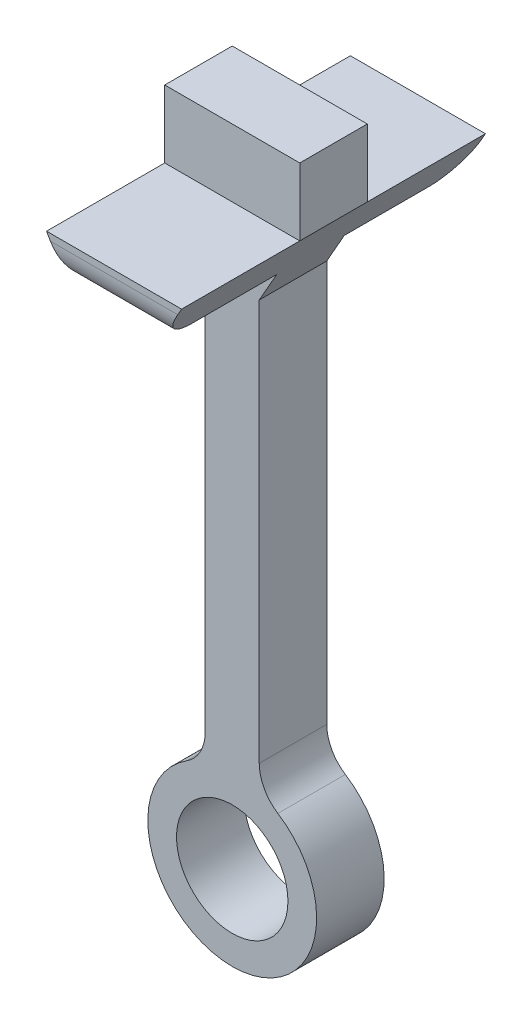
from build123d import *

# Parameters (mm, degrees)
ESQUISSE1_R             = 1.65
BOSS_EXTRU_1_DEPTH      = 2
CONG_1_R                = 1.2
BOSS_EXTRU_3_DEPTH      = 3.5
BOSS_EXTRU_3_DEPTH_BACK = 5.5
CONG_2_R                = 1


with BuildPart() as part:
    # Esquisse1 → Boss.-Extru.1 (new body)
    with BuildSketch(Plane.XY):
        with BuildLine():
            Line((1.198395722, -3.48698903), (2.398395722, -1.372264328))
            Line((2.398395722, -1.372264328), (2.398395722, 0.627735672))
            Line((2.398395722, 0.627735672), (-1.601604278, 0.627735672))
            Line((-1.601604278, 0.627735672), (-1.601604278, -1.372264328))
            Line((-1.601604278, -1.372264328), (-0.401604278, -3.48698903))
            Line((-0.401604278, -3.48698903), (-0.401604278, -16.118445174))
            ThreePointArc((-0.401604278, -16.118445174), (0.398395722, -20.98698903), (1.198395722, -16.118445174))
            Line((1.198395722, -16.118445174), (1.198395722, -3.48698903))
        make_face()
        with Locations((0.398395722, -18.48698903)):
            Circle(ESQUISSE1_R, mode=Mode.SUBTRACT)
    extrude(amount=BOSS_EXTRU_1_DEPTH)

    # Congé1
    cong_1_edges = [part.edges().sort_by_distance(p)[0] for p in [
        (-0.401604278, -16.118445174, 1),
        (1.198395722, -16.118445174, 1),
    ]]
    fillet(cong_1_edges, radius=CONG_1_R)

    # Esquisse4 → Boss.-Extru.3 (add, two sides: drawn at the far end of the back side and taken through both)
    with BuildSketch(Plane(origin=(0, 0, 0), x_dir=(-1, 0, 0), z_dir=(0, 0, -1)).offset(-BOSS_EXTRU_3_DEPTH_BACK)):
        Polygon((-2.398395722, -1.372264328), (1.601604278, -1.372264328), (0.92066458, -2.572264328), (-1.717456024, -2.572264328), align=None)
    extrude(amount=BOSS_EXTRU_3_DEPTH + BOSS_EXTRU_3_DEPTH_BACK)

    # Congé2
    cong_2_edges = [part.edges().sort_by_distance(p)[0] for p in [
        (0.398395722, -2.572264328, 5.5),
        (0.398395722, -2.572264328, -3.5),
    ]]
    fillet(cong_2_edges, radius=CONG_2_R)


solid = part.part
